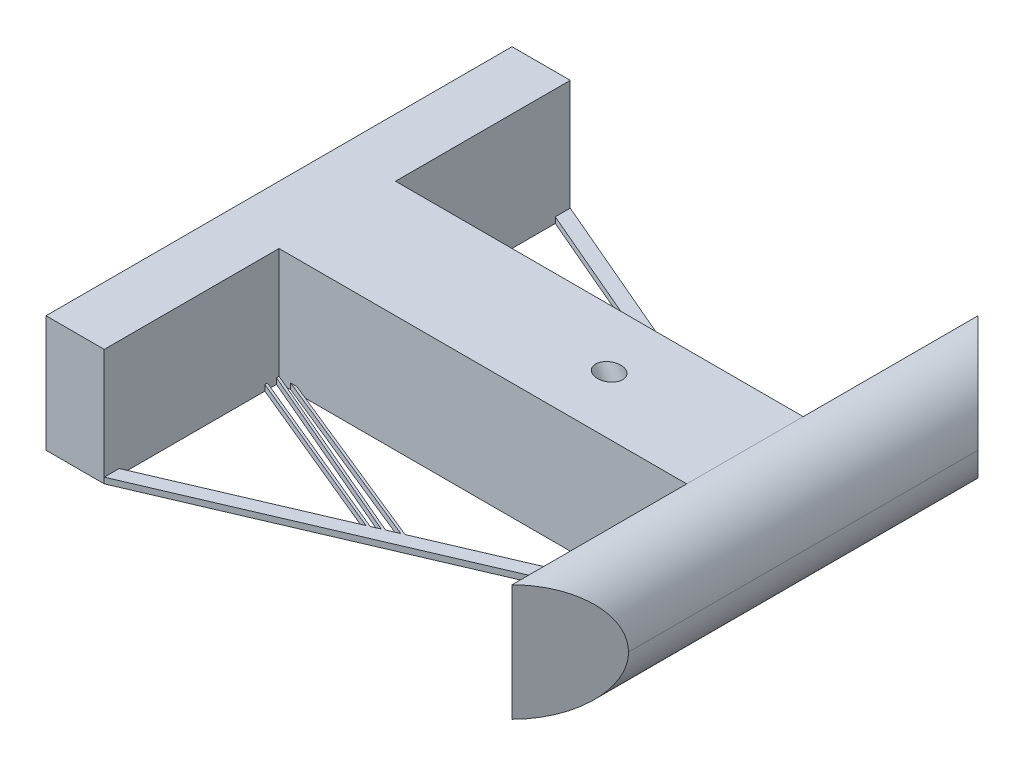
from build123d import *

# Parameters (mm, degrees)
SKETCH2_W               = 508
SKETCH2_H               = 127
BOSS_EXTRUDE1_DEPTH     = 63.5
SKETCH3_W               = 127
SKETCH3_H               = 127
BOSS_EXTRUDE2_DEPTH     = 444.5
SKETCH4_W               = 31.75
SKETCH4_H               = 31.75
CUT_EXTRUDE1_DEPTH      = 38.1
SKETCH5_R               = 12.7
CUT_EXTRUDE2_DEPTH      = 50.8
BOSS_EXTRUDE3_DEPTH     = 6.35
EXTRUDE_THIN1_START     = -6.35
EXTRUDE_THIN1_DEPTH     = 6.35
BOSS_EXTRUDE4_DEPTH     = 127
FILLET1_R               = 63.5
CUT_EXTRUDE3_DEPTH      = 583.156936495
CUT_EXTRUDE3_DEPTH_BACK = 583.156936495
SKETCH13_R              = 12.7


# Read off the part's stored shape, not the designer's step: Extrude-Thin1
with BuildPart() as part:
    # Sketch2 → Boss-Extrude1 (new body)
    with BuildSketch(Plane(origin=(0, 0, 0), x_dir=(0, 0, -1), z_dir=(1, 0, 0))):
        Rectangle(SKETCH2_W, SKETCH2_H)
    extrude(amount=BOSS_EXTRUDE1_DEPTH)

    # Sketch3 → Boss-Extrude2 (add)
    with BuildSketch(Plane(origin=(63.5, 0, 0), x_dir=(0, 0, -1), z_dir=(1, 0, 0))):
        Rectangle(SKETCH3_W, SKETCH3_H)
    extrude(amount=BOSS_EXTRUDE2_DEPTH)

    # Sketch4 → Cut-Extrude1 (cut)
    with BuildSketch(Plane.ZY):
        Rectangle(SKETCH4_W, SKETCH4_H)
    extrude(amount=-CUT_EXTRUDE1_DEPTH, mode=Mode.SUBTRACT)

    # Sketch5 → Cut-Extrude2 (cut)
    with BuildSketch(Plane.ZY.offset(-38.1)):
        Circle(SKETCH5_R)
    extrude(amount=-CUT_EXTRUDE2_DEPTH, mode=Mode.SUBTRACT)

    # Sketch10 → Boss-Extrude3 (add)
    with BuildSketch(Plane.XZ.offset(63.5)):
        Polygon((63.5, 254), (508, 63.5), (469.9, 63.5), (63.5, 237.671428571), align=None)
    boss_extrude3 = extrude(amount=-BOSS_EXTRUDE3_DEPTH)

    # Mirror1: Boss-Extrude3 across plane
    add(boss_extrude3.mirror(Plane.XY))

    # Extrude-Thin1 outline → Extrude-Thin1 (add)
    with BuildSketch(Plane(origin=(0, -57.15, 0), x_dir=(1, 0, 0), z_dir=(0, 1, 0)).offset(EXTRUDE_THIN1_START)):
        Polygon((82.952073355, -63.5), (76.2, -63.5), (278.373141881, -145.582939194), (281.657885075, -144.175192111), align=None)
        Polygon((266.7, -150.585714286), (63.5, -63.5), (63.5, -66.26343767), (263.475989385, -151.967433121), align=None)
        Polygon((255.026858119, -155.588489378), (63.5, -76.2), (63.5, -78.949557774), (251.765512342, -156.986208996), align=None)
    extrude_thin1 = extrude(amount=EXTRUDE_THIN1_DEPTH)

    # Mirror2: Extrude-Thin1 across plane
    add(extrude_thin1.mirror(Plane.XY))

    # Sketch12 → Boss-Extrude4 (add)
    with BuildSketch(Plane(origin=(0, 63.5, 0), x_dir=(1, 0, 0), z_dir=(0, 1, 0))):
        Polygon((508, 254), (508, 63.5), (571.5, 63.5), (571.5, 190.5), align=None)
        Polygon((571.5, 63.5), (508, 63.5), (508, -63.5), (508, -254), (571.5, -190.5), align=None)
    extrude(amount=-BOSS_EXTRUDE4_DEPTH)

    # Fillet1
    fillet1_edges = [part.edges().sort_by_distance(p)[0] for p in [
        (571.5, -63.5, 0),
        (571.5, 63.5, 0),
    ]]
    fillet(fillet1_edges, radius=FILLET1_R - 0.0001)  # a hair under: the kernel refuses the full size

    # Sketch13 → Cut-Extrude3 (cut, two sides: drawn at the far end of the back side and taken through both)
    with BuildSketch(Plane(origin=(106.321850008, -177.331865581, 0), x_dir=(0, 0, -1), z_dir=(-0.5142209424211187, 0.857657753638091, 0)).offset(-CUT_EXTRUDE3_DEPTH_BACK)):
        with Locations(Location((0, -341.343168692, 0), (0, 0, 90))):
            Circle(SKETCH13_R)
    extrude(amount=CUT_EXTRUDE3_DEPTH + CUT_EXTRUDE3_DEPTH_BACK, mode=Mode.SUBTRACT)


solid = part.part
